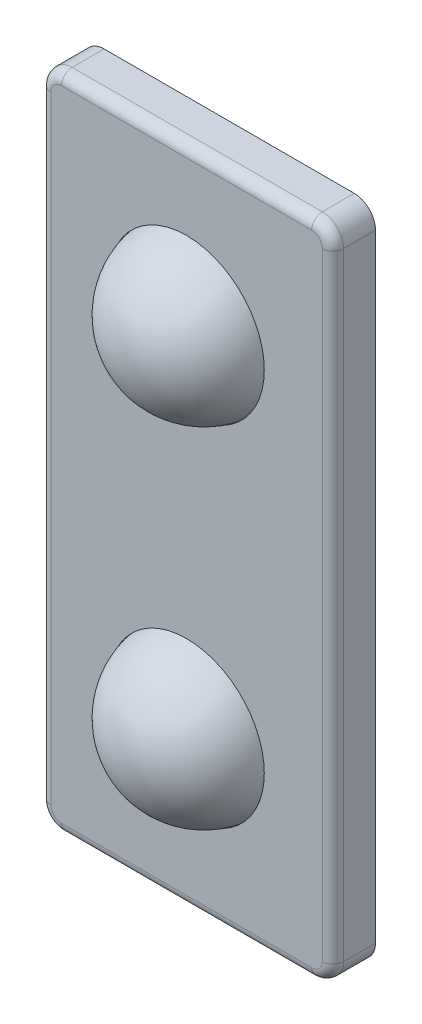
from build123d import *

# Parameters (mm, degrees)
SKETCH1_W           = 10.25
SKETCH1_H           = 27.5
BOSS_EXTRUDE1_DEPTH = 0.5
SKETCH2_W           = 13.75
SKETCH2_H           = 31
BOSS_EXTRUDE2_DEPTH = 2
FILLET1_R           = 1
FILLET2_R           = 0.5
SKETCH3_R           = 3.65
CUT_EXTRUDE1_DEPTH  = 0.1


# Read off the part's stored shape, not the designer's step: Dome1, Dome2
with BuildPart() as part:
    # Sketch1 → Boss-Extrude1 (new body)
    with BuildSketch(Plane.XY):
        Rectangle(SKETCH1_W, SKETCH1_H)
    extrude(amount=BOSS_EXTRUDE1_DEPTH)

    # Sketch2 → Boss-Extrude2 (add)
    with BuildSketch(Plane.XY.offset(0.5)):
        Rectangle(SKETCH2_W, SKETCH2_H)
    extrude(amount=BOSS_EXTRUDE2_DEPTH)

    # Fillet1
    fillet1_edges = [part.edges().sort_by_distance(p)[0] for p in [
        (6.875, -15.5, 1.5),
        (6.875, 15.5, 1.5),
        (-6.875, 15.5, 1.5),
        (-6.875, -15.5, 1.5),
    ]]
    fillet(fillet1_edges, radius=FILLET1_R)

    # Fillet2
    fillet2_edges = [part.edges().sort_by_distance(p)[0] for p in [
        (0, 15.5, 2.5),
        (6.875, 0, 2.5),
        (-6.875, 0, 2.5),
        (0, -15.5, 2.5),
        (-6.582106781, 15.207106781, 2.5),
        (-6.582106781, -15.207106781, 2.5),
        (6.582106781, -15.207106781, 2.5),
        (6.582106781, 15.207106781, 2.5),
    ]]
    fillet(fillet2_edges, radius=FILLET2_R)

    # Sketch3 → Cut-Extrude1 (cut)
    with BuildSketch(Plane.XY.offset(2.5)):
        with Locations((0, 8.2)):
            Circle(SKETCH3_R)
    cut_extrude1 = extrude(amount=-CUT_EXTRUDE1_DEPTH, mode=Mode.SUBTRACT)

    # Mirror1: Cut-Extrude1 across plane
    add(cut_extrude1.mirror(Plane.ZX), mode=Mode.SUBTRACT)

    # Dome1 outline → Dome1 (revolve)
    with BuildSketch(Plane.XZ.offset(-8.2)):
        with BuildLine():
            Line((0, 2.4), (3.650000001, 2.399999996))
            ThreePointArc((3.650000001, 2.399999996), (2.362334652, 4.553757157), (0, 5.4))
            Line((0, 5.4), (0, 2.4))
        make_face()
    revolve(axis=Axis((0, 8.2, 0), (0, 0, 1)))

    # Dome2 outline → Dome2 (revolve)
    with BuildSketch(Plane.XZ.offset(8.2)):
        with BuildLine():
            Line((0, 2.4), (3.650000001, 2.399999996))
            ThreePointArc((3.650000001, 2.399999996), (2.362334652, 4.553757157), (0, 5.4))
            Line((0, 5.4), (0, 2.4))
        make_face()
    revolve(axis=Axis((0, -8.2, 0), (0, 0, 1)))


solid = part.part
